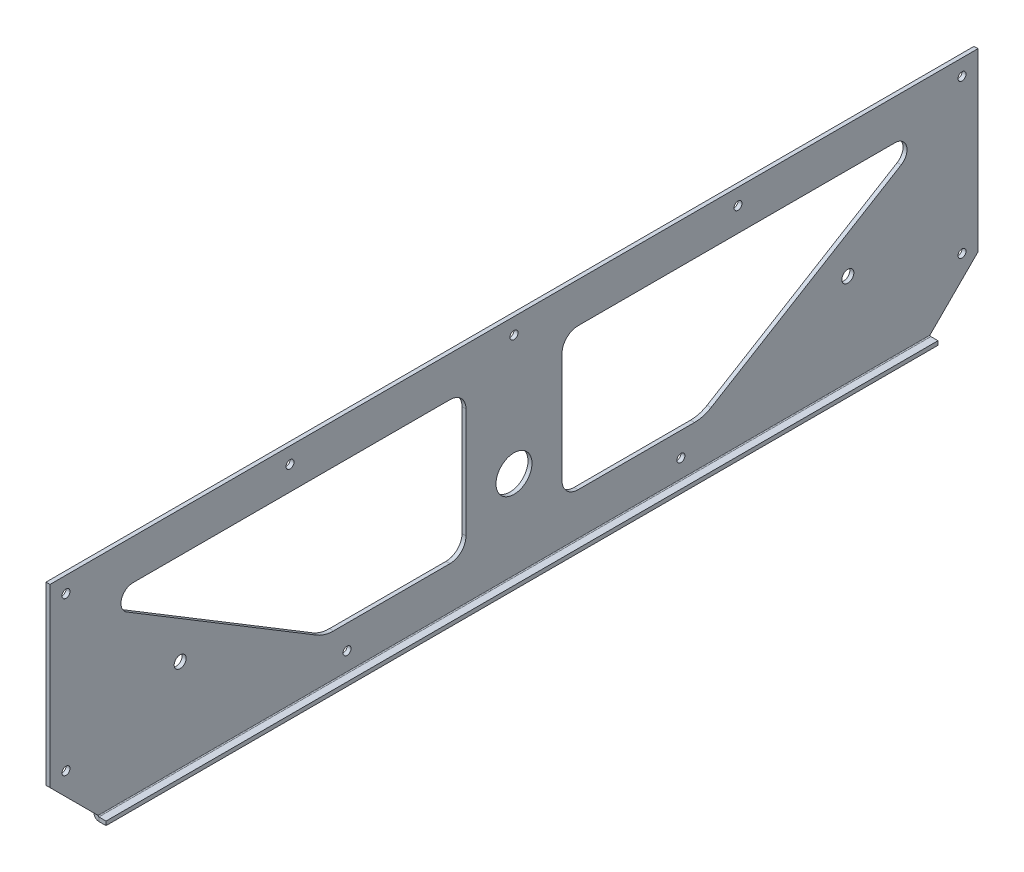
from build123d import *

# Parameters (mm, degrees)
BASE_FLANGE1_DEPTH = 3.175
EDGE_FLANGE1_DEPTH = 660.4
SKETCH9_R          = 3.175
SKETCH9_R_2        = 14.2875
SKETCH9_R_3        = 4.7625
CUT_EXTRUDE1_DEPTH = 410.020846046
CUT_EXTRUDE2_DEPTH = 410.082455778


# Sheet-metal steps are written as plain solids
with BuildPart() as part:
    # Sketch1 → Base-Flange1 (new body)
    with BuildSketch(Plane(origin=(0, 0, 0), x_dir=(0, 0, -1), z_dir=(1, 0, 0))):
        Polygon((330.2, 0), (-330.2, 0), (-368.3, 38.1), (-368.3, 177.8), (368.3, 177.8), (368.3, 38.1), align=None)
    extrude(amount=-BASE_FLANGE1_DEPTH)

    # Edge-Flange1 section (across the edge) → Edge-Flange1 (add)
    with BuildSketch(Plane(origin=(0, -0.7366, 330.2), x_dir=(0, 1, 0), z_dir=(0, 0, -1))):
        with BuildLine():
            Line((-3.175, 0.7366), (-3.175, 6.35))
            Line((-3.175, 6.35), (0, 6.35))
            Line((0, 6.35), (0, 0.7366))
            ThreePointArc((0, 0.7366), (0.215745145, 0.215745145), (0.7366, 0))
            Line((0.7366, 0), (0.7366, -3.175))
            ThreePointArc((0.7366, -3.175), (-2.029318885, -2.029318885), (-3.175, 0.7366))
        make_face()
    extrude(amount=EDGE_FLANGE1_DEPTH)

    # Sketch9 → Cut-Extrude1 (cut, through all)
    with BuildSketch(Plane(origin=(0, 0, 0), x_dir=(0, 0, -1), z_dir=(1, 0, 0))):
        with Locations((-355.6, 165.1)):
            Circle(SKETCH9_R)
        with Locations((-355.6, 43.360512242)):
            Circle(SKETCH9_R)
        with Locations((-177.8, 165.1)):
            Circle(SKETCH9_R)
        with Locations((0, 165.1)):
            Circle(SKETCH9_R)
        with Locations((-132.489589571, 14.2875)):
            Circle(SKETCH9_R)
        with Locations((132.489589571, 14.2875)):
            Circle(SKETCH9_R)
        with Locations((177.8, 165.1)):
            Circle(SKETCH9_R)
        with Locations((355.6, 165.1)):
            Circle(SKETCH9_R)
        with Locations(Location((355.6, 43.360512242, 0), (0, 0, 180))):
            Circle(SKETCH9_R)
        with Locations((0, 69.85)):
            Circle(SKETCH9_R_2)
        with Locations((-264.979179141, 73.025)):
            Circle(SKETCH9_R_3)
        with Locations((264.979179141, 73.025)):
            Circle(SKETCH9_R_3)
    extrude(amount=-CUT_EXTRUDE1_DEPTH, mode=Mode.SUBTRACT)

    # Sketch10 → Cut-Extrude2 (cut, through all)
    with BuildSketch(Plane.ZY.offset(3.175)):
        with BuildLine():
            Line((-302.426875206, 146.05), (-50.8, 146.05))
            ThreePointArc((-50.8, 146.05), (-41.819743879, 142.330256121), (-38.1, 133.35))
            Line((-38.1, 133.35), (-38.1, 46.0375))
            ThreePointArc((-38.1, 46.0375), (-41.819743879, 37.057243879), (-50.8, 33.3375))
            Line((-50.8, 33.3375), (-143.295855515, 33.3375))
            ThreePointArc((-143.295855515, 33.3375), (-150.12485752, 34.272734895), (-156.450968109, 37.009568376))
            Line((-156.450968109, 37.009568376), (-307.360042429, 128.377025641))
            ThreePointArc((-307.360042429, 128.377025641), (-311.60116212, 139.085875752), (-302.426875206, 146.05))
        make_face()
        with BuildLine():
            Line((38.1, 133.35), (38.1, 46.0375))
            ThreePointArc((38.1, 46.0375), (41.819743879, 37.057243879), (50.8, 33.3375))
            Line((50.8, 33.3375), (143.295855515, 33.3375))
            ThreePointArc((143.295855515, 33.3375), (150.12485752, 34.272734895), (156.450968109, 37.009568376))
            Line((156.450968109, 37.009568376), (307.360042429, 128.377025641))
            ThreePointArc((307.360042429, 128.377025641), (311.60116212, 139.085875752), (302.426875206, 146.05))
            Line((302.426875206, 146.05), (50.8, 146.05))
            ThreePointArc((50.8, 146.05), (41.819743879, 142.330256121), (38.1, 133.35))
        make_face()
    extrude(amount=-CUT_EXTRUDE2_DEPTH, mode=Mode.SUBTRACT)


solid = part.part
